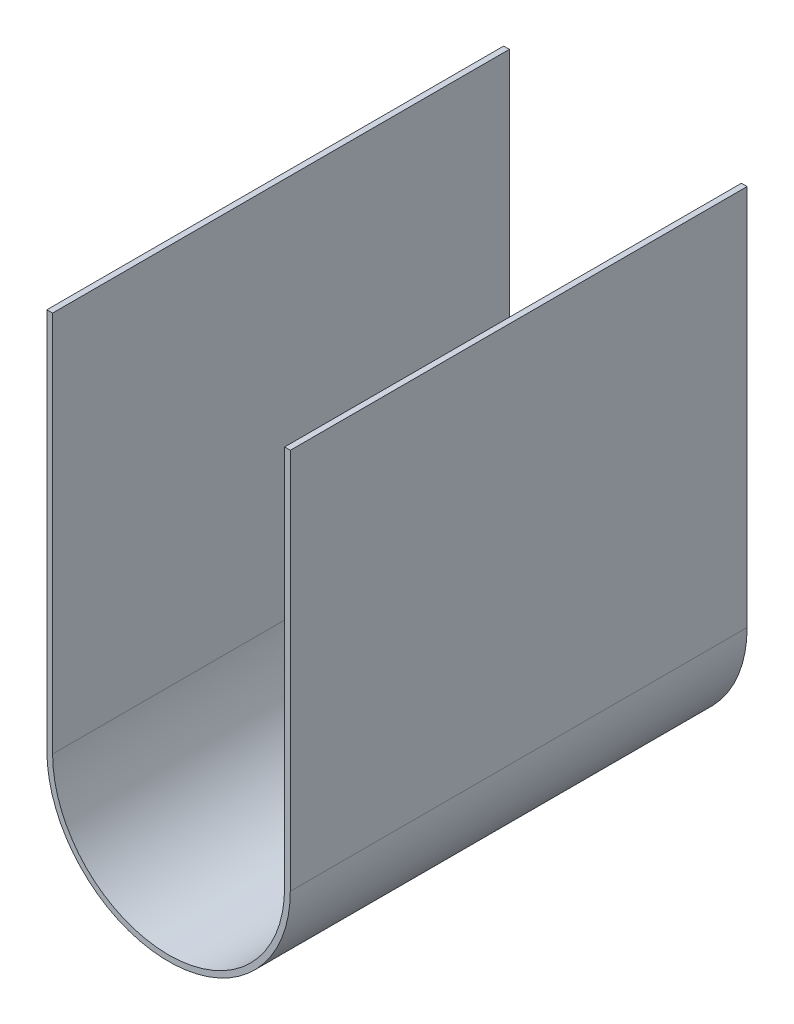
from build123d import *

# Parameters (mm, degrees)
SKETCH1_R                = 14
BOSS_EXTRUDE1_DEPTH      = 6
M3_CLEARANCE_HOLE1_D     = 3.6
M3_CLEARANCE_HOLE1_DEPTH = 6
M3_CLEARANCE_HOLE1_TIP   = 1.081549114
FILLET1_R                = 15
SKETCH4_W                = 65
SKETCH4_H                = 9
CUT_EXTRUDE1_DEPTH       = 2
M4_CLEARANCE_HOLE1_D     = 4.8
M4_CLEARANCE_HOLE1_DEPTH = 6
M4_CLEARANCE_HOLE1_TIP   = 1.442065486
CHAMFER1_SIZE            = 2.4
BOSS_EXTRUDE2_DEPTH      = 128
SKETCH10_W               = 128
SKETCH10_H               = 68
CUT_EXTRUDE2_DEPTH       = 195.170157336


with BuildPart() as part:
    # Sketch1 → Boss-Extrude1 (new body)
    with BuildSketch(Plane.XY):
        with BuildLine():
            Line((-32.5, 95), (-32.5, -95))
            ThreePointArc((-32.5, -95), (0, -127.5), (32.5, -95))
            Line((32.5, -95), (32.5, 95))
            Line((32.5, 95), (-32.5, 95))
        make_face()
        with Locations((0, -95)):
            Circle(SKETCH1_R, mode=Mode.SUBTRACT)
    extrude(amount=BOSS_EXTRUDE1_DEPTH)

    # M3 Clearance Hole1
    with Locations(Plane(origin=(0, 0, 0), x_dir=(-1, 0, 0), z_dir=(0, 0, -1))):
        with Locations((-15.5, -110.5), (15.5, -110.5), (15.5, -79.5), (-15.5, -79.5)):
            Hole(M3_CLEARANCE_HOLE1_D / 2, depth=M3_CLEARANCE_HOLE1_DEPTH)
            with Locations((0, 0, -(M3_CLEARANCE_HOLE1_DEPTH + M3_CLEARANCE_HOLE1_TIP / 2))):  # 118° drill point
                Cone(0, M3_CLEARANCE_HOLE1_D / 2, M3_CLEARANCE_HOLE1_TIP, mode=Mode.SUBTRACT)

    # Fillet1
    fillet1_edges = [part.edges().sort_by_distance(p)[0] for p in [
        (-32.5, 95, 3),
        (32.5, 95, 3),
    ]]
    fillet(fillet1_edges, radius=FILLET1_R)

    # Sketch4 → Cut-Extrude1 (cut)
    with BuildSketch(Plane.XY.offset(6)):
        with Locations((0, -60.5)):
            Rectangle(SKETCH4_W, SKETCH4_H)
        with Locations((0, 7.5)):
            Rectangle(SKETCH4_W, SKETCH4_H)
        with Locations((0, 75.5)):
            Rectangle(SKETCH4_W, SKETCH4_H)
    extrude(amount=-CUT_EXTRUDE1_DEPTH, mode=Mode.SUBTRACT)

    # M4 Clearance Hole1
    with Locations(Plane.XY.offset(4)):
        with Locations((-24.5, -60.5), (-24.5, 75.5), (24.5, 75.5), (0, 75.5), (-24.5, 7.5), (0, 7.5), (24.5, 7.5), (24.5, -60.5), (0, -60.5)):
            Hole(M4_CLEARANCE_HOLE1_D / 2, depth=M4_CLEARANCE_HOLE1_DEPTH)
            with Locations((0, 0, -(M4_CLEARANCE_HOLE1_DEPTH + M4_CLEARANCE_HOLE1_TIP / 2))):  # 118° drill point
                Cone(0, M4_CLEARANCE_HOLE1_D / 2, M4_CLEARANCE_HOLE1_TIP, mode=Mode.SUBTRACT)

    # Chamfer1
    chamfer1_edges = [part.edges().sort_by_distance(p)[0] for p in [
        (13.7, -110.5, 0),
        (-17.3, -110.5, 0),
        (-17.3, -79.5, 0),
        (13.7, -79.5, 0),
        (-22.1, 75.5, 0),
        (2.4, 75.5, 0),
        (26.9, 75.5, 0),
        (26.9, 7.5, 0),
        (2.4, 7.5, 0),
        (-22.1, 7.5, 0),
        (-22.1, -60.5, 0),
        (2.4, -60.5, 0),
        (26.9, -60.5, 0),
    ]]
    chamfer(chamfer1_edges, length=CHAMFER1_SIZE)


with BuildPart() as body_2:
    # Sketch7 → Boss-Extrude2 (new body)
    with BuildSketch(Plane(origin=(0, 0, 0), x_dir=(-1, 0, 0), z_dir=(0, 0, -1))):
        with BuildLine():
            ThreePointArc((-34.1, -95), (0, -129.1), (34.1, -95))
            Line((34.1, -95), (34.1, 80))
            Line((34.1, 80), (32.5, 80))
            Line((32.5, 80), (32.5, -95))
            ThreePointArc((32.5, -95), (0, -127.5), (-32.5, -95))
            Line((-32.5, -95), (-32.5, 80))
            Line((-32.5, 80), (-34.1, 80))
            Line((-34.1, 80), (-34.1, -95))
        make_face()
    extrude(amount=-BOSS_EXTRUDE2_DEPTH)

    # Sketch10 → Cut-Extrude2 (cut, through all)
    with BuildSketch(Plane(origin=(34.1, 0, 0), x_dir=(0, 0, -1), z_dir=(1, 0, 0))):
        with Locations((-64, 46)):
            Rectangle(SKETCH10_W, SKETCH10_H)
    extrude(amount=-CUT_EXTRUDE2_DEPTH, mode=Mode.SUBTRACT)


solid = body_2.part
